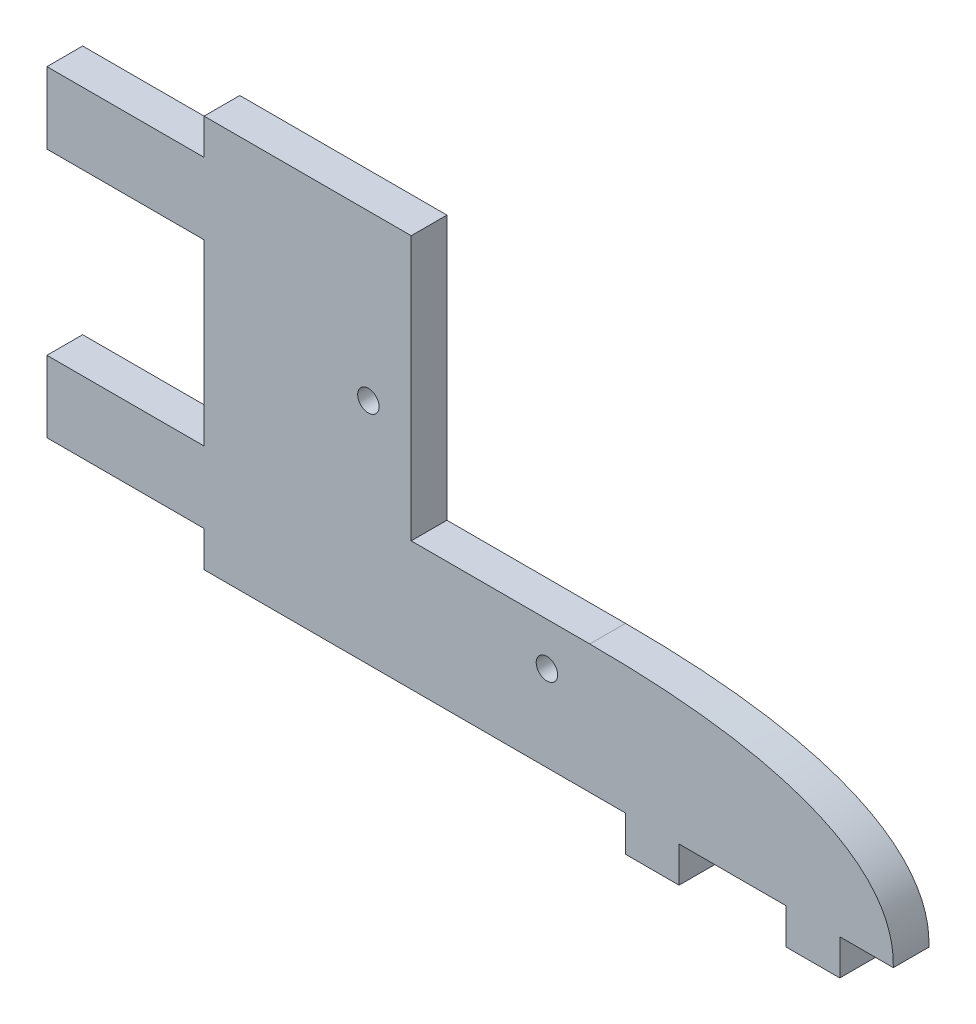
from build123d import *

# Parameters (mm, degrees)
ESQUISSE1_R        = 1.5
BOSS_EXTRU_1_DEPTH = 5
BOSS_EXTRU_2_DEPTH = 5


with BuildPart() as part:
    # Esquisse1 → Boss.-Extru.1 (new body)
    with BuildSketch(Plane.XY):
        Polygon((0, 0), (37, 0), (37, 18), (12, 18), (12, 55), (0, 55), align=None)
        with Locations((6, 32)):
            Circle(ESQUISSE1_R, mode=Mode.SUBTRACT)
        with Locations((31, 12)):
            Circle(ESQUISSE1_R, mode=Mode.SUBTRACT)
    extrude(amount=BOSS_EXTRU_1_DEPTH)

    # Esquisse2 → Boss.-Extru.2 (add)
    with BuildSketch(Plane.XY.offset(5)):
        with BuildLine():
            Line((37, 0), (42, 0))
            Line((42, 0), (42, -5))
            Line((42, -5), (49.5, -5))
            Line((49.5, -5), (49.5, 0))
            Line((49.5, 0), (64.5, 0))
            Line((64.5, 0), (64.5, -5))
            Line((64.5, -5), (72, -5))
            Line((72, -5), (72, 0))
            Line((72, 0), (79.5, 0))
            add(Edge.make_bspline(
                [(37, 18), (79.239532327, 18), (79.5, 3.874285435), (79.5, 0)],
                knots=[0, 0, 0, 0, 1, 1, 1, 1], degree=3))
            Line((37, 18), (37, 0))
        make_face()
        Polygon((0, 0), (-17, 0), (-17, 5), (-39, 5), (-39, 15), (-17, 15), (-17, 40), (-39, 40), (-39, 50), (-17, 50), (-17, 55), (0, 55), align=None)
    extrude(amount=-BOSS_EXTRU_2_DEPTH)


solid = part.part
